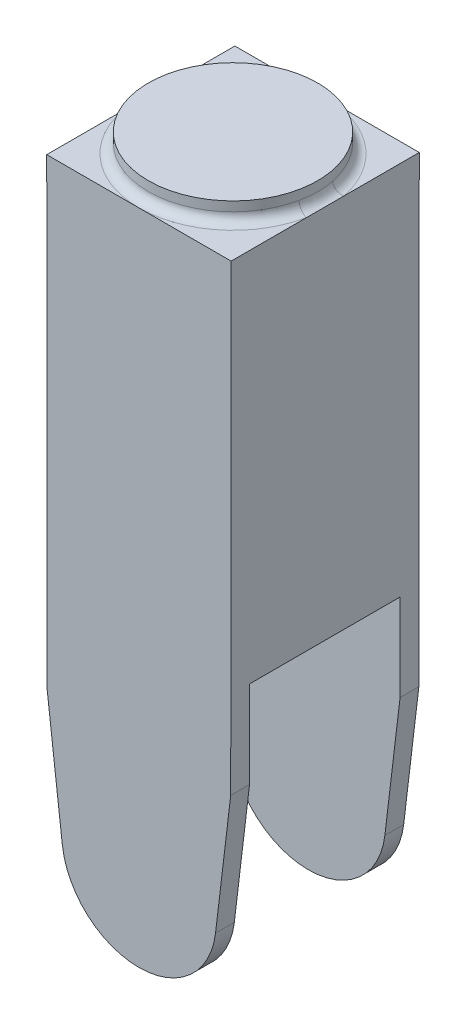
from build123d import *

# Parameters (mm, degrees)
BOSS_EXTRUDE1_DEPTH      = 50
BOSS_EXTRUDE1_DEPTH_BACK = 50
SKETCH2_W                = 80
SKETCH2_H                = 150
CUT_EXTRUDE1_DEPTH       = 367.509355196
SKETCH3_R                = 45
BOSS_EXTRUDE2_DEPTH      = 10
FILLET1_R                = 5


with BuildPart() as part:
    # Sketch1 → Boss-Extrude1 (new, two sides: drawn at the far end of the back side and taken through both)
    with BuildSketch(Plane.XY.offset(-BOSS_EXTRUDE1_DEPTH_BACK)):
        with BuildLine():
            Line((-49, 0), (49, 0))
            Line((49, 0), (48.785008207, -245.999906054))
            Line((48.785008207, -245.999906054), (40.709882529, -313.518735615))
            ThreePointArc((40.709882529, -313.518735615), (0, -349.649909839), (-40.709882529, -313.518735615))
            Line((-40.709882529, -313.518735615), (-48.785008207, -245.999906054))
            Line((-48.785008207, -245.999906054), (-49, 0))
        make_face()
    extrude(amount=BOSS_EXTRUDE1_DEPTH + BOSS_EXTRUDE1_DEPTH_BACK)

    # Sketch2 → Cut-Extrude1 (cut, through all)
    with BuildSketch(Plane(origin=(48.999962574, -0.042823552, 0), x_dir=(0, 0, -1), z_dir=(0.9999996181052956, -0.0008739503779168433, 0))):
        with Locations((0, -274.649791967)):
            Rectangle(SKETCH2_W, SKETCH2_H)
    extrude(amount=-CUT_EXTRUDE1_DEPTH, mode=Mode.SUBTRACT)

    # Sketch3 → Boss-Extrude2 (add)
    with BuildSketch(Plane(origin=(0, 0, 0), x_dir=(1, 0, 0), z_dir=(0, 1, 0))):
        with Locations(Location((0, 0, 0), (0, 0, 270))):
            Circle(SKETCH3_R)
    extrude(amount=BOSS_EXTRUDE2_DEPTH)

    # Fillet1
    fillet1_edges = [part.edges().sort_by_distance(p)[0] for p in [
        (0, 0, -45),
    ]]
    fillet(fillet1_edges, radius=FILLET1_R - 0.0001)  # a hair under: the kernel refuses the full size


with BuildPart() as part_1:
    # Body-Move/Copy1: moved
    add(part.part.moved(Location((0, 308.649909839, 0))))


solid = part_1.part
